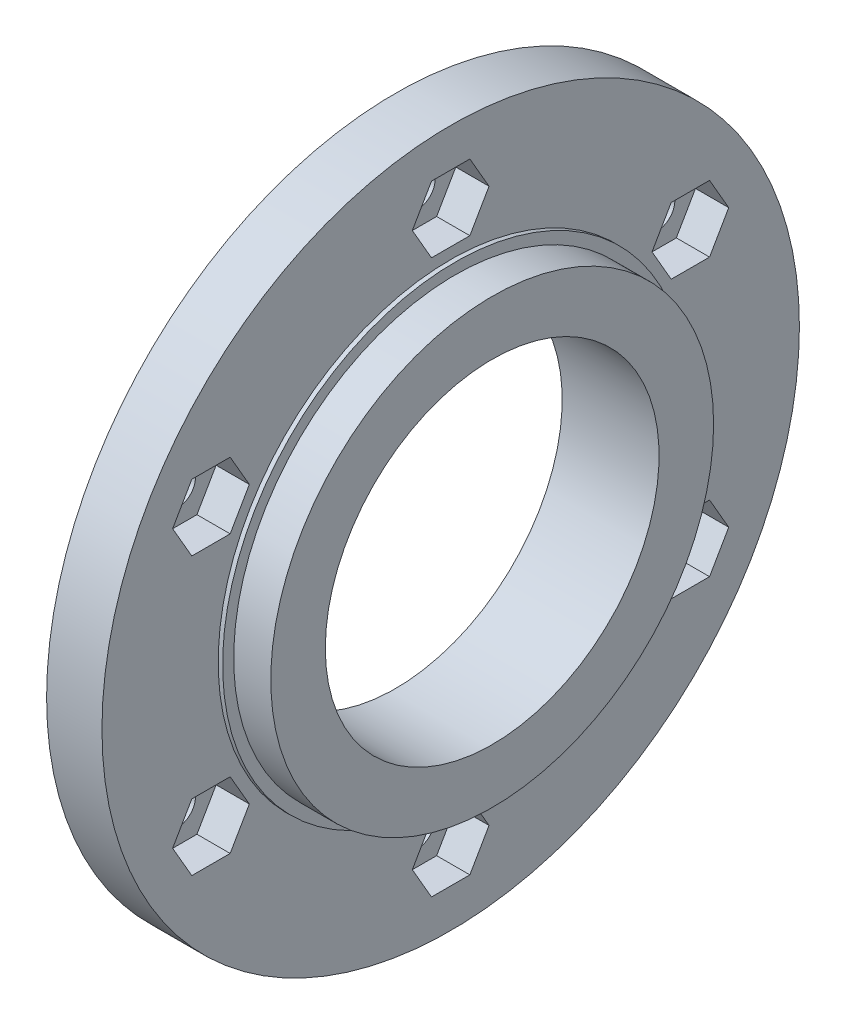
from build123d import *

# Parameters (mm, degrees)
SKIZZE2_R                        = 15.075
SCHNITT_LINEAR_AUSTRAGEN1_DEPTH  = 46.398926199
SCHNITT_LINEAR_AUSTRAGEN2_DEPTH  = 3
KREISMUSTER1_COUNT               = 6
F_3_2_3_2_DURCHMESSER_BOHRUNG1_D = 3.2
KREISMUSTER2_COUNT               = 6


with BuildPart() as part:
    # Skizze1 → Rotation1 (revolve)
    with BuildSketch(Plane.XY):
        Polygon((0, 0), (0, 31.5), (5, 31.5), (5, 21), (5.4, 21), (5.4, 20), (8.75, 20), (8.75, 0), align=None)
    revolve(axis=Axis((0, 0, 0), (-1, 0, 0)))

    # Skizze2 → Schnitt-Linear austragen1 (cut, through all)
    with BuildSketch(Plane.ZY):
        Circle(SKIZZE2_R)
    extrude(amount=-SCHNITT_LINEAR_AUSTRAGEN1_DEPTH, mode=Mode.SUBTRACT)

    # Skizze3 → Schnitt-Linear austragen2 (cut)
    with BuildSketch(Plane(origin=(5, 0, 0), x_dir=(0, 0, -1), z_dir=(1, 0, 0))):
        Polygon((1.732050808, 22), (3.464101615, 25), (1.732050808, 28), (-1.732050808, 28), (-3.464101615, 25), (-1.732050808, 22), align=None)
    schnitt_linear_austragen2 = extrude(amount=-SCHNITT_LINEAR_AUSTRAGEN2_DEPTH, mode=Mode.SUBTRACT)

    # Kreismuster1: Schnitt-Linear austragen2 ×6 about axis
    kreismuster1_axis = Axis((8.75, 0, 0), (-1, 0, 0))
    for i in range(1, KREISMUSTER1_COUNT):
        add(schnitt_linear_austragen2.rotate(kreismuster1_axis, i * 360 / KREISMUSTER1_COUNT), mode=Mode.SUBTRACT)

    # Ø3.2 (3.2) Durchmesser Bohrung1 (through all)
    with Locations(Plane(origin=(5, 0, 0), x_dir=(0, 0, -1), z_dir=(1, 0, 0))):
        with Locations((0, 25)):
            f_3_2_3_2_durchmesser_bohrung1 = Hole(F_3_2_3_2_DURCHMESSER_BOHRUNG1_D / 2)

    # Kreismuster2: Ø3.2 (3.2) Durchmesser Bohrung1 ×6 about axis
    kreismuster2_axis = Axis((8.75, 0, 0), (-1, 0, 0))
    for i in range(1, KREISMUSTER2_COUNT):
        add(f_3_2_3_2_durchmesser_bohrung1.rotate(kreismuster2_axis, i * 360 / KREISMUSTER2_COUNT), mode=Mode.SUBTRACT)


solid = part.part
